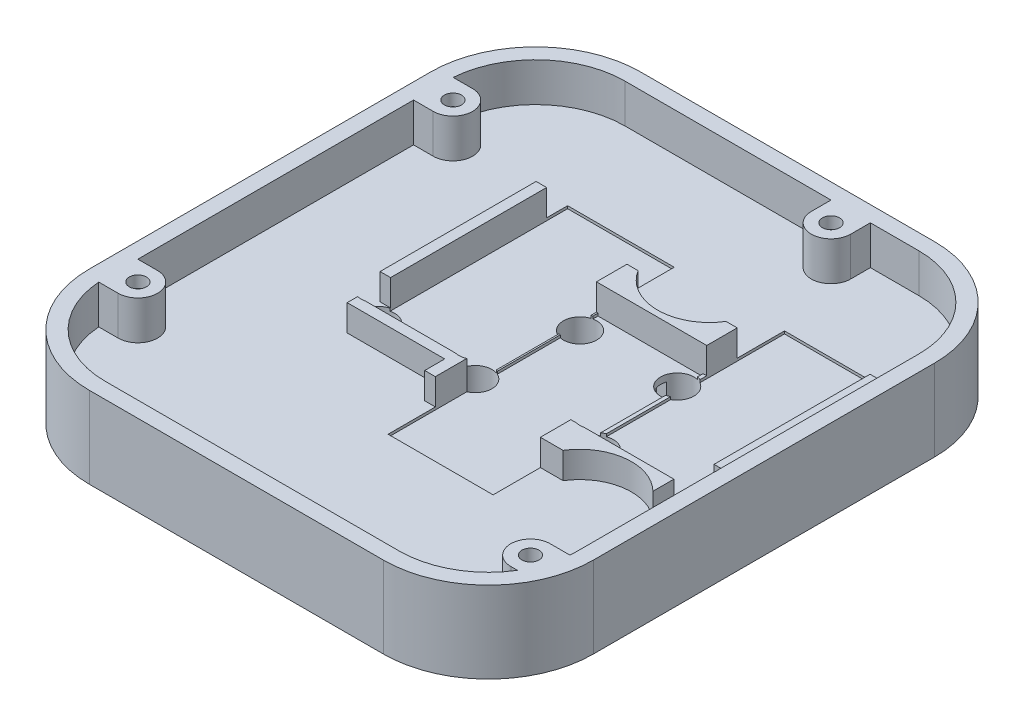
from build123d import *
from build123d.topology import SkipClean

# Parameters (mm, degrees)
BASE_DEPTH                                     = 1.75
RIDGE_DEPTH                                    = 7.4
SKETCH2_2_R                                    = 3.175
TENDON_HOLES_DEPTH                             = 19.100507065
TUBE_HOLE_DEPTH                                = 6.35
CBORE_FOR_4_SOCKET_HEAD_CAP_SCREW1_D           = 3.2639
CBORE_FOR_4_SOCKET_HEAD_CAP_SCREW1_CBORE_D     = 5.55752
CBORE_FOR_4_SOCKET_HEAD_CAP_SCREW1_CBORE_DEPTH = 13.2448046
SKETCH7_R                                      = 1.85
HEAT_SINK_INSERTS_DEPTH                        = 3.5
SKETCH8_R                                      = 2.77876
MATERIAL_REMOVAL_DEPTH                         = 5
BLOCK_START                                    = 5
SKETCH9_W                                      = 2
SKETCH9_H                                      = 29.715522991
SKETCH9_W_2                                    = 3.7
BLOCK_HOLDERS_DEPTH                            = 5
SKETCH10_W                                     = 20.3
SKETCH10_H                                     = 39.980522991
SKETCH10_W_2                                   = 20
BLOCK_GROVE_DEPTH                              = 0.5


# Read off the part's stored shape, not the designer's step: tube hole
with BuildPart() as part:
    # Sketch1 → base (new body)
    with BuildSketch(Plane(origin=(0, 0, 0), x_dir=(1, 0, 0), z_dir=(0, 1, 0))):
        with BuildLine():
            Line((-28, 52.5), (28, 52.5))
            ThreePointArc((28, 52.5), (42.142135624, 46.642135624), (48, 32.5))
            Line((48, 32.5), (48, -32.5))
            ThreePointArc((48, -32.5), (42.142135624, -46.642135624), (28, -52.5))
            Line((28, -52.5), (-28, -52.5))
            ThreePointArc((-28, -52.5), (-42.142135624, -46.642135624), (-48, -32.5))
            Line((-48, -32.5), (-48, 32.5))
            ThreePointArc((-48, 32.5), (-42.142135624, 46.642135624), (-28, 52.5))
        make_face()
    extrude(amount=BASE_DEPTH)

    # Sketch2 → ridge (add)
    with BuildSketch(Plane(origin=(0, 1.75, 0), x_dir=(1, 0, 0), z_dir=(0, 1, 0))):
        with BuildLine():
            ThreePointArc((-28, 52.5), (-42.142135624, 46.642135624), (-48, 32.5))
            Line((-48, 32.5), (-48, -32.5))
            ThreePointArc((-48, -32.5), (-42.142135624, -46.642135624), (-28, -52.5))
            Line((-28, -52.5), (28, -52.5))
            ThreePointArc((28, -52.5), (42.142135624, -46.642135624), (48, -32.5))
            Line((48, -32.5), (48, 32.5))
            ThreePointArc((48, 32.5), (42.142135624, 46.642135624), (28, 52.5))
            Line((28, 52.5), (-28, 52.5))
        make_face()
        with BuildLine():
            Line((11.25, 49.5), (11.25, 45.75))
            ThreePointArc((11.25, 45.75), (15, 42), (18.75, 45.75))
            Line((18.75, 45.75), (18.75, 49.5))
            Line((18.75, 49.5), (28, 49.5))
            ThreePointArc((28, 49.5), (40.02081528, 44.52081528), (45, 32.5))
            Line((45, 32.5), (45, -5.551485316))
            ThreePointArc((45, -5.551485316), (45.02305106, -6), (45, -6.448514684))
            Line((45, -6.448514684), (45, -32.5))
            ThreePointArc((45, -32.5), (44.985141083, -33.210621121), (44.940590308, -33.92))
            Line((44.940590308, -33.92), (41.190590308, -33.92))
            ThreePointArc((41.190590308, -33.92), (37.440590308, -37.67), (41.190590308, -41.42))
            Line((41.190590308, -41.42), (42.471820894, -41.42))
            ThreePointArc((42.471820894, -41.42), (36.287339742, -47.343180252), (28, -49.5))
            Line((28, -49.5), (-28, -49.5))
            ThreePointArc((-28, -49.5), (-39.570436465, -44.954918707), (-44.953981833, -33.75))
            Line((-44.953981833, -33.75), (-41.25, -33.75))
            ThreePointArc((-41.25, -33.75), (-37.5, -30), (-41.25, -26.25))
            Line((-41.25, -26.25), (-45, -26.25))
            Line((-45, -26.25), (-45, 26.25))
            Line((-45, 26.25), (-41.25, 26.25))
            ThreePointArc((-41.25, 26.25), (-37.5, 30), (-41.25, 33.75))
            Line((-41.25, 33.75), (-44.953981833, 33.75))
            ThreePointArc((-44.953981833, 33.75), (-39.570436465, 44.954918707), (-28, 49.5))
            Line((-28, 49.5), (11.25, 49.5))
        make_face(mode=Mode.SUBTRACT)
    extrude(amount=RIDGE_DEPTH)

    # Sketch2<2> → tendon holes (cut)
    with BuildSketch(Plane(origin=(0, 1.75, 0), x_dir=(1, 0, 0), z_dir=(0, 1, 0))):
        with Locations(Location((-19.493567898, -6, 0), (0, 0, 270))):
            Circle(SKETCH2_2_R)
        with Locations(Location((-0.993567898, -6, 0), (0, 0, 270))):
            Circle(SKETCH2_2_R)
        with Locations(Location((0.963920797, 12, 0), (0, 0, 270))):
            Circle(SKETCH2_2_R)
        with Locations(Location((22.14805106, -6, 0), (0, 0, 270))):
            Circle(SKETCH2_2_R)
        with Locations(Location((19.463920797, 12, 0), (0, 0, 270))):
            Circle(SKETCH2_2_R)
        with Locations(Location((40.64805106, -6, 0), (0, 0, 270))):
            Circle(SKETCH2_2_R)
    extrude(amount=-TENDON_HOLES_DEPTH, mode=Mode.SUBTRACT)

    # tube hole outline → tube hole (add)
    with BuildSketch(Plane.XZ):
        with BuildLine():
            Line((28, 52.5), (-28, 52.5))
            ThreePointArc((-28, 52.5), (-42.142135624, 46.642135624), (-48, 32.5))
            Line((-48, 32.5), (-48, -32.5))
            ThreePointArc((-48, -32.5), (-42.142135624, -46.642135624), (-28, -52.5))
            Line((-28, -52.5), (28, -52.5))
            ThreePointArc((28, -52.5), (42.142135624, -46.642135624), (48, -32.5))
            Line((48, -32.5), (48, 32.5))
            ThreePointArc((48, 32.5), (42.142135624, 46.642135624), (28, 52.5))
        make_face()
        with BuildLine():
            ThreePointArc((-16.480160358, 5), (-22.668567898, 6), (-16.480160358, 7))
            Line((-16.480160358, 7), (-4.006975438, 7))
            ThreePointArc((-4.006975438, 7), (2.181432102, 6), (-4.006975438, 5))
            Line((-4.006975438, 5), (-7.068567898, 5))
            Line((-7.068567898, 5), (-7.068567898, -27.923737342))
            Line((-7.068567898, -27.923737342), (-28.248737342, -27.923737342))
            Line((-28.248737342, -27.923737342), (-28.248737342, -21.573737342))
            Line((-28.248737342, -21.573737342), (-13.418567898, -21.573737342))
            Line((-13.418567898, -21.573737342), (-13.418567898, 5))
            Line((-13.418567898, 5), (-16.480160358, 5))
        make_face(mode=Mode.SUBTRACT)
        with BuildLine():
            ThreePointArc((25.1614586, 5), (18.97305106, 6), (25.1614586, 7))
            Line((25.1614586, 7), (37.63464352, 7))
            ThreePointArc((37.63464352, 7), (43.82305106, 6), (37.63464352, 5))
            Line((37.63464352, 5), (34.580798399, 5))
            Line((34.580798399, 5), (34.580798399, -27.923737342))
            Line((34.580798399, -27.923737342), (21.248737342, -27.923737342))
            Line((21.248737342, -27.923737342), (21.248737342, -21.573737342))
            Line((21.248737342, -21.573737342), (28.230798399, -21.573737342))
            Line((28.230798399, -21.573737342), (28.230798399, 5))
            Line((28.230798399, 5), (25.1614586, 5))
        make_face(mode=Mode.SUBTRACT)
        with BuildLine():
            ThreePointArc((3.977328337, -13), (-2.211079203, -12), (3.977328337, -11))
            Line((3.977328337, -11), (7.038920797, -11))
            Line((7.038920797, -11), (7.038920797, 31.82))
            Line((7.038920797, 31.82), (-3.5, 31.82))
            Line((-3.5, 31.82), (-3.5, 38.17))
            Line((-3.5, 38.17), (13.388920797, 38.17))
            Line((13.388920797, 38.17), (13.388920797, -11))
            Line((13.388920797, -11), (16.450513257, -11))
            ThreePointArc((16.450513257, -11), (22.638920797, -12), (16.450513257, -13))
            Line((16.450513257, -13), (3.977328337, -13))
        make_face(mode=Mode.SUBTRACT)
    extrude(amount=TUBE_HOLE_DEPTH)

    # CBORE for #4 Socket Head Cap Screw1 (through all)
    with Locations(Plane(origin=(0, -6.35, 0), x_dir=(-1, 0, 0), z_dir=(0, -1, 0))):
        with Locations((-41.190590308, -37.67), (-15, 45.75), (41.25, 30), (41.25, -30)):
            CounterBoreHole(CBORE_FOR_4_SOCKET_HEAD_CAP_SCREW1_D / 2, CBORE_FOR_4_SOCKET_HEAD_CAP_SCREW1_CBORE_D / 2, CBORE_FOR_4_SOCKET_HEAD_CAP_SCREW1_CBORE_DEPTH)

    # Sketch7 → heat sink inserts (cut)
    with BuildSketch(Plane.XZ.offset(6.35)):
        with Locations(Location((-27.142135624, 46.642135624, 0), (0, 0, 270))):
            Circle(SKETCH7_R)
        with Locations(Location((27.142135624, 46.642135624, 0), (0, 0, 270))):
            Circle(SKETCH7_R)
        with Locations(Location((27.142135624, -46.642135624, 0), (0, 0, 270))):
            Circle(SKETCH7_R)
        with Locations(Location((-27.142135624, -46.642135624, 0), (0, 0, 270))):
            Circle(SKETCH7_R)
    extrude(amount=-HEAT_SINK_INSERTS_DEPTH, mode=Mode.SUBTRACT)

    # Sketch8 → material removal (cut)
    with BuildSketch(Plane.XZ.offset(6.35)):
        with BuildLine():
            ThreePointArc((-31.992135624, 49.024613556), (-41.357887288, 43.015077137), (-45, 32.5))
            Line((-45, 32.5), (-45, -32.5))
            ThreePointArc((-45, -32.5), (-41.357887288, -43.015077137), (-31.992135624, -49.024613556))
            Line((-31.992135624, -49.024613556), (-31.992135624, -46.642135624))
            ThreePointArc((-31.992135624, -46.642135624), (-27.142135624, -41.792135624), (-22.292135624, -46.642135624))
            Line((-22.292135624, -46.642135624), (-22.292135624, -49.5))
            Line((-22.292135624, -49.5), (22.292135624, -49.5))
            Line((22.292135624, -49.5), (22.292135624, -46.642135624))
            ThreePointArc((22.292135624, -46.642135624), (27.142135624, -41.792135624), (31.992135624, -46.642135624))
            Line((31.992135624, -46.642135624), (31.992135624, -49.024613556))
            ThreePointArc((31.992135624, -49.024613556), (41.357887288, -43.015077137), (45, -32.5))
            Line((45, -32.5), (45, 3.521862509))
            ThreePointArc((45, 3.521862509), (41.661431366, 1.095544336), (37.63464352, 2))
            Line((37.63464352, 2), (37.580798399, 2))
            Line((37.580798399, 2), (37.580798399, -30.923737342))
            Line((37.580798399, -30.923737342), (18.248737342, -30.923737342))
            Line((18.248737342, -30.923737342), (18.248737342, -18.573737342))
            Line((18.248737342, -18.573737342), (25.230798399, -18.573737342))
            Line((25.230798399, -18.573737342), (25.230798399, 2))
            Line((25.230798399, 2), (25.161458599, 2))
            ThreePointArc((25.161458599, 2), (17.464675006, 7.773869708), (27.055252401, 7))
            Line((27.055252401, 7), (35.740849719, 7))
            ThreePointArc((35.740849719, 7), (39.858558237, 10.945434873), (45, 8.478137491))
            Line((45, 8.478137491), (45, 32.5))
            ThreePointArc((45, 32.5), (41.357887288, 43.015077137), (31.992135624, 49.024613556))
            Line((31.992135624, 49.024613556), (31.992135624, 46.642135624))
            ThreePointArc((31.992135624, 46.642135624), (27.142135624, 41.792135624), (22.292135624, 46.642135624))
            Line((22.292135624, 46.642135624), (22.292135624, 49.5))
            Line((22.292135624, 49.5), (-22.292135624, 49.5))
            Line((-22.292135624, 49.5), (-22.292135624, 46.642135624))
            ThreePointArc((-22.292135624, 46.642135624), (-27.142135624, 41.792135624), (-31.992135624, 46.642135624))
            Line((-31.992135624, 46.642135624), (-31.992135624, 49.024613556))
        make_face()
        with Locations(Location((-41.25, -30, 0), (0, 0, 270))):
            Circle(SKETCH8_R, mode=Mode.SUBTRACT)
        with BuildLine():
            Line((-16.418567898, 2), (-16.480160358, 2))
            ThreePointArc((-16.480160358, 2), (-24.176943951, 7.773869708), (-14.586366557, 7))
            Line((-14.586366557, 7), (-5.900769238, 7))
            ThreePointArc((-5.900769238, 7), (-0.491031415, 10.982778551), (4.014488113, 6))
            ThreePointArc((4.014488113, 6), (1.241304723, 1.518262684), (-4.006975437, 2))
            Line((-4.006975437, 2), (-4.068567898, 2))
            Line((-4.068567898, 2), (-4.068567898, -30.923737342))
            Line((-4.068567898, -30.923737342), (-31.248737342, -30.923737342))
            Line((-31.248737342, -30.923737342), (-31.248737342, -18.573737342))
            Line((-31.248737342, -18.573737342), (-16.418567898, -18.573737342))
            Line((-16.418567898, -18.573737342), (-16.418567898, 2))
        make_face(mode=Mode.SUBTRACT)
        with Locations(Location((15, -45.75, 0), (0, 0, 270))):
            Circle(SKETCH8_R, mode=Mode.SUBTRACT)
        with Locations(Location((-41.25, 30, 0), (0, 0, 270))):
            Circle(SKETCH8_R, mode=Mode.SUBTRACT)
        with BuildLine():
            Line((16.388920797, -8), (16.450513257, -8))
            ThreePointArc((16.450513257, -8), (21.698793418, -7.518262684), (24.471976807, -12))
            ThreePointArc((24.471976807, -12), (19.966457279, -16.982778551), (14.556719456, -13))
            Line((14.556719456, -13), (5.871122138, -13))
            ThreePointArc((5.871122138, -13), (-3.719455257, -13.773869708), (3.977328337, -8))
            Line((3.977328337, -8), (4.038920797, -8))
            Line((4.038920797, -8), (4.038920797, 28.82))
            Line((4.038920797, 28.82), (-6.5, 28.82))
            Line((-6.5, 28.82), (-6.5, 41.17))
            Line((-6.5, 41.17), (16.388920797, 41.17))
            Line((16.388920797, 41.17), (16.388920797, -8))
        make_face(mode=Mode.SUBTRACT)
        with Locations(Location((41.190590308, 37.67, 0), (0, 0, 270.00000001))):
            Circle(SKETCH8_R, mode=Mode.SUBTRACT)
    extrude(amount=-MATERIAL_REMOVAL_DEPTH, mode=Mode.SUBTRACT)

    # Sketch9 → block holders (add)
    with SkipClean():  # the faces are left unmerged after this step: merging them gives an invalid solid
        with BuildSketch(Plane(origin=(0, 1.75, 0), x_dir=(1, 0, 0), z_dir=(0, 1, 0)).offset(BLOCK_START)):
            with BuildLine():
                Line((-20.3, -11.09), (-1.723311003, -11.09))
                Line((-1.723311003, -11.09), (-1.723311003, -14.895))
                Line((-1.723311003, -14.895), (0.3, -14.895))
                Line((0.3, -14.895), (0.3, -8.899535669))
                ThreePointArc((0.3, -8.899535669), (-0.696004855, -9.161025346), (-1.723311003, -9.09))
                Line((-1.723311003, -9.09), (-18.763824792, -9.09))
                ThreePointArc((-18.763824792, -9.09), (-19.493567898, -9.175), (-20.223311003, -9.09))
                Line((-20.223311003, -9.09), (-20.3, -9.09))
                Line((-20.3, -9.09), (-20.3, -11.09))
            make_face()
            with BuildLine():
                Line((20.3, -9.09), (20.3, -14.895))
                Line((20.3, -14.895), (24.620491284, -14.895))
                ThreePointArc((24.620491284, -14.895), (31.831724637, -10.303901106), (39.918307954, -13.076489388))
                Line((39.918307954, -13.076489388), (39.918307954, -9.09))
                Line((39.918307954, -9.09), (22.877794165, -9.09))
                ThreePointArc((22.877794165, -9.09), (22.14805106, -9.175), (21.418307954, -9.09))
                Line((21.418307954, -9.09), (20.3, -9.09))
            make_face()
            with BuildLine():
                Line((2.125455236, 21.890522991), (0, 21.890522991))
                Line((0, 21.890522991), (0, 16.085522991))
                Line((0, 16.085522991), (21, 16.085522991))
                Line((21, 16.085522991), (21, 21.890522991))
                Line((21, 21.890522991), (18.874544764, 21.890522991))
                ThreePointArc((18.874544764, 21.890522991), (10.5, 17.230522991), (2.125455236, 21.890522991))
            make_face()
            with Locations((-21.3, 12.032761496)):
                Rectangle(SKETCH9_W, SKETCH9_H)
            with Locations((43.15, 12.032761496)):
                Rectangle(SKETCH9_W_2, SKETCH9_H)
        extrude(amount=-BLOCK_HOLDERS_DEPTH)

    # Sketch10 → block grove (cut)
    with BuildSketch(Plane(origin=(0, 1.75, 0), x_dir=(1, 0, 0), z_dir=(0, 1, 0))):
        with Locations((-10.15, 10.900261496)):
            Rectangle(SKETCH10_W, SKETCH10_H)
        with Locations((10.3, -3.904738505)):
            Rectangle(SKETCH10_W_2, SKETCH10_H)
        with Locations((31.15, 10.900261496)):
            Rectangle(SKETCH10_W, SKETCH10_H)
    extrude(amount=-BLOCK_GROVE_DEPTH, mode=Mode.SUBTRACT)


solid = part.part
